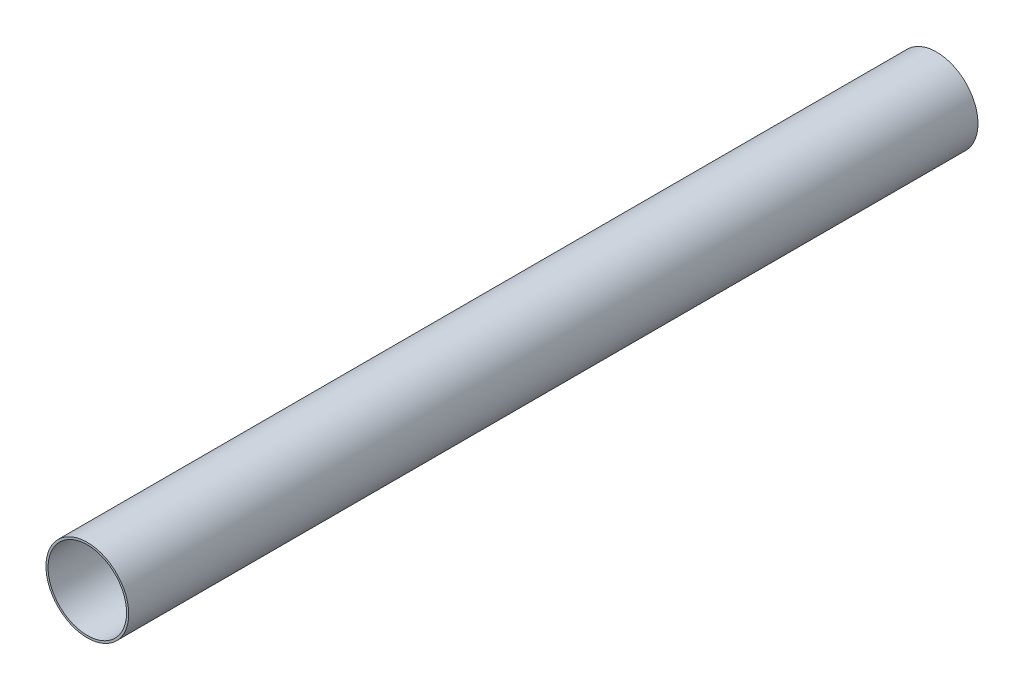
from build123d import *

# Parameters (mm, degrees)
SKETCH1_R      = 49
SKETCH1_R_2    = 46.482
EXTRUDE1_DEPTH = 1005.332


with BuildPart() as part:
    # Sketch1 → Extrude1 (new body)
    with BuildSketch(Plane.XY):
        Circle(SKETCH1_R)
        Circle(SKETCH1_R_2, mode=Mode.SUBTRACT)
    extrude(amount=EXTRUDE1_DEPTH)


solid = part.part
